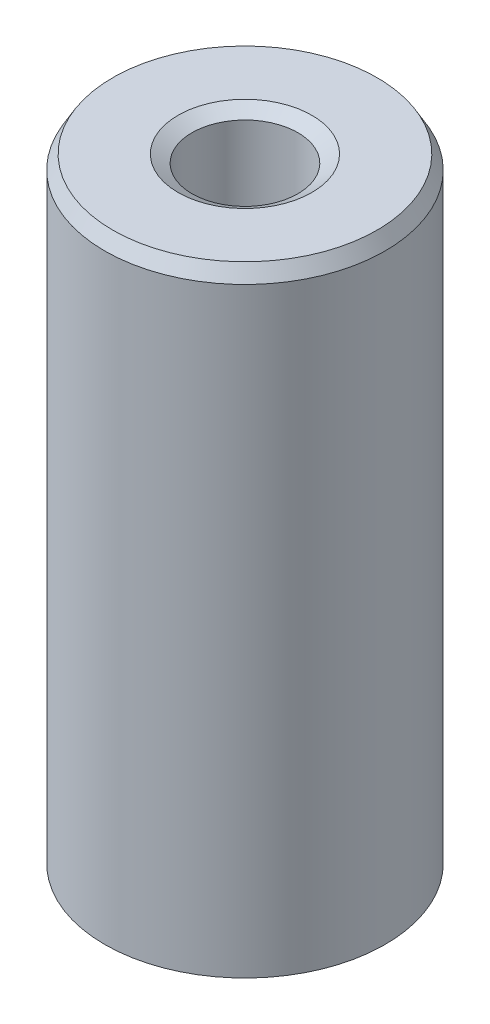
from build123d import *
from OCP.BRepFilletAPI import BRepFilletAPI_MakeChamfer

# Parameters (mm, degrees)
SKETCH1_R           = 12.5
BOSS_EXTRUDE1_DEPTH = 55.513123501
SKETCH2_R           = 4.720082796
CUT_EXTRUDE1_DEPTH  = 59.259822183
CHAMFER1_SIZE       = 1.245910995
CHAMFER1_SIZE2      = 0.719327048


with BuildPart() as part:
    # Sketch1 → Boss-Extrude1 (new body)
    with BuildSketch(Plane(origin=(0, 0, 0), x_dir=(1, 0, 0), z_dir=(0, 1, 0))):
        Circle(SKETCH1_R)
    extrude(amount=BOSS_EXTRUDE1_DEPTH)

    # Sketch2 → Cut-Extrude1 (cut, through all)
    with BuildSketch(Plane(origin=(0, 0, 0), x_dir=(1, 0, 0), z_dir=(0, 1, 0))):
        Circle(SKETCH2_R)
    extrude(amount=CUT_EXTRUDE1_DEPTH, mode=Mode.SUBTRACT)

    # Chamfer1: one chamfer whose edges measure the first distance from different faces: ONE call of the kernel's chamfer builder (chamfer() names one face for all edges)
    chamfer1_edges_1 = [part.edges().sort_by_distance(p)[0] for p in [
        (-4.720082796, 55.513123501, 0),
    ]]
    chamfer1_side_1 = [part.faces().sort_by_distance(p)[0] for p in [
        (-12.146446609, 55.513123501, 0),
    ]]
    chamfer1_edges_2 = [part.edges().sort_by_distance(p)[0] for p in [
        (-4.720082796, 0, 0),
    ]]
    chamfer1_side_2 = [part.faces().sort_by_distance(p)[0] for p in [
        (-4.720082796, 27.756561751, 0),
    ]]
    chamfer1_edges_3 = [part.edges().sort_by_distance(p)[0] for p in [
        (-12.5, 0, 0),
    ]]
    chamfer1_side_3 = [part.faces().sort_by_distance(p)[0] for p in [
        (-12.146446609, 0, 0),
    ]]
    chamfer1_edges_4 = [part.edges().sort_by_distance(p)[0] for p in [
        (-12.5, 55.513123501, 0),
    ]]
    chamfer1_side_4 = [part.faces().sort_by_distance(p)[0] for p in [
        (-12.5, 27.756561751, 0),
    ]]
    chamfer1 = BRepFilletAPI_MakeChamfer(part.part.solid().wrapped)
    for e in chamfer1_edges_1:
        chamfer1.Add(CHAMFER1_SIZE, CHAMFER1_SIZE2, e.wrapped, chamfer1_side_1[0].wrapped)  # the first distance lies on this face
    for e in chamfer1_edges_2:
        chamfer1.Add(CHAMFER1_SIZE, CHAMFER1_SIZE2, e.wrapped, chamfer1_side_2[0].wrapped)  # the first distance lies on this face
    for e in chamfer1_edges_3:
        chamfer1.Add(CHAMFER1_SIZE, CHAMFER1_SIZE2, e.wrapped, chamfer1_side_3[0].wrapped)  # the first distance lies on this face
    for e in chamfer1_edges_4:
        chamfer1.Add(CHAMFER1_SIZE, CHAMFER1_SIZE2, e.wrapped, chamfer1_side_4[0].wrapped)  # the first distance lies on this face
    add(Compound.cast(chamfer1.Shape()), mode=Mode.REPLACE)


solid = part.part
